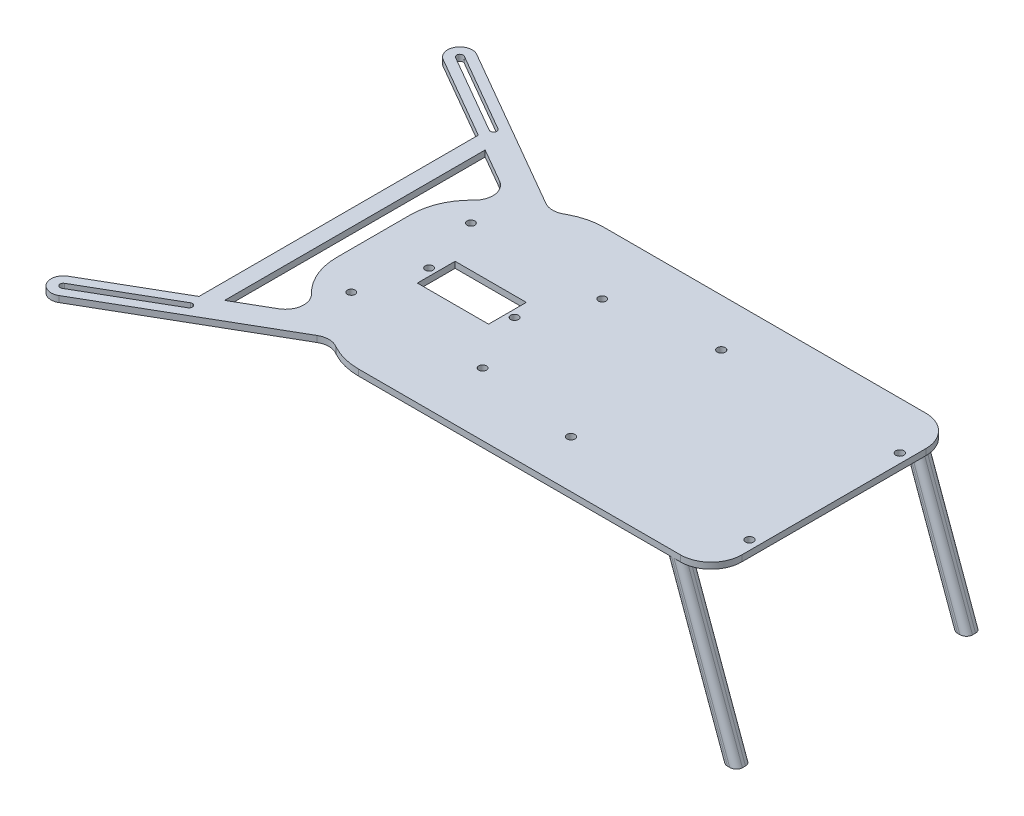
from build123d import *

# Parameters (mm, degrees)
SKETCH_1_W                  = 150
SKETCH_1_H                  = 80
SKETCH_1_R                  = 1.25
EXTRUDE_1_DEPTH             = 2
SKETCH_2_R                  = 1.3
CUT_EXTRUDE_1_DEPTH         = 2
CUT_EXTRUDE_2_DEPTH         = 2
FILLET_1_R                  = 20
FILLET_2_R                  = 10
CUT_EXTRUDE_3_REACH         = 87.024
SKETCH_4_R                  = 1.25
SKETCH_4_W                  = 23.2
SKETCH_4_H                  = 12.3
EXTRUDE_2_DEPTH             = 5
FILLET_5_R                  = 2
EXTRUDE_3_DEPTH             = 2
FILLET_6_R                  = 6
EXTRUDE_4_REACH             = 145.372
SKETCH_7_W                  = 5.296380997
SKETCH_7_H                  = 2
EXTRUDE_4_DIRECTION_2_REACH = 145.372


with BuildPart() as part:
    # 草图1 → 凸台-拉伸1 (new body)
    with BuildSketch(Plane(origin=(0, 0, 0), x_dir=(1, 0, 0), z_dir=(0, 1, 0))):
        Rectangle(SKETCH_1_W, SKETCH_1_H)
        with Locations((-62.8, 19.5)):
            Circle(SKETCH_1_R, mode=Mode.SUBTRACT)
        with Locations((-20, 19.5)):
            Circle(SKETCH_1_R, mode=Mode.SUBTRACT)
        with Locations((-20, -19.5)):
            Circle(SKETCH_1_R, mode=Mode.SUBTRACT)
        with Locations((-62.8, -19.5)):
            Circle(SKETCH_1_R, mode=Mode.SUBTRACT)
    extrude(amount=EXTRUDE_1_DEPTH)

    # 草图2 → 切除-拉伸1 (cut)
    with BuildSketch(Plane(origin=(0, 2, 0), x_dir=(1, 0, 0), z_dir=(0, 1, 0))):
        with Locations((13.8, 24.5)):
            Circle(SKETCH_2_R)
        with Locations((72, 24.5)):
            Circle(SKETCH_2_R)
        with Locations((13.8, -24.5)):
            Circle(SKETCH_2_R)
        with Locations((72, -24.5)):
            Circle(SKETCH_2_R)
    extrude(amount=-CUT_EXTRUDE_1_DEPTH, mode=Mode.SUBTRACT)

    # 草图3 → 切除-拉伸2 (cut)
    with BuildSketch(Plane(origin=(0, 2, 0), x_dir=(1, 0, 0), z_dir=(0, 1, 0))):
        Polygon((-75, 40), (-45, 40), (-75, 24), align=None)
        Polygon((-45, -40), (-75, -24), (-75, -40), align=None)
    extrude(amount=-CUT_EXTRUDE_2_DEPTH, mode=Mode.SUBTRACT)

    # 圆角1
    fillet_1_edges = [part.edges().sort_by_distance(p)[0] for p in [
        (-45, 1, -40),
        (-75, 1, -24),
        (-45, 1, 40),
        (-75, 1, 24),
    ]]
    fillet(fillet_1_edges, radius=FILLET_1_R)

    # 圆角2
    fillet_2_edges = [part.edges().sort_by_distance(p)[0] for p in [
        (75, 1, -40),
        (75, 1, 40),
    ]]
    fillet(fillet_2_edges, radius=FILLET_2_R)

    # 草图4 → 切除-拉伸3 (cut, up to next)
    with BuildSketch(Plane(origin=(0, 2, 0), x_dir=(1, 0, 0), z_dir=(0, 1, 0)), mode=Mode.PRIVATE) as cut_extrude_3_sk1:
        with Locations((-29.075, 0)):
            Circle(SKETCH_4_R)
    cut_extrude_3_tool1 = extrude(cut_extrude_3_sk1.sketch, amount=-CUT_EXTRUDE_3_REACH, mode=Mode.PRIVATE) & part.part
    # 草图4 → 切除-拉伸3 (cut, up to next)
    with BuildSketch(Plane(origin=(0, 2, 0), x_dir=(1, 0, 0), z_dir=(0, 1, 0)), mode=Mode.PRIVATE) as cut_extrude_3_sk2:
        with Locations((-56.925, 0)):
            Circle(SKETCH_4_R)
    cut_extrude_3_tool2 = extrude(cut_extrude_3_sk2.sketch, amount=-CUT_EXTRUDE_3_REACH, mode=Mode.PRIVATE) & part.part
    # 草图4 → 切除-拉伸3 (cut, up to next)
    with BuildSketch(Plane(origin=(0, 2, 0), x_dir=(1, 0, 0), z_dir=(0, 1, 0)), mode=Mode.PRIVATE) as cut_extrude_3_sk3:
        with Locations((-43, 0)):
            Rectangle(SKETCH_4_W, SKETCH_4_H)
    cut_extrude_3_tool3 = extrude(cut_extrude_3_sk3.sketch, amount=-CUT_EXTRUDE_3_REACH, mode=Mode.PRIVATE) & part.part
    add(cut_extrude_3_tool1.solids().sort_by_distance((-29.075, 2, 0))[0], mode=Mode.SUBTRACT)
    add(cut_extrude_3_tool2.solids().sort_by_distance((-56.925, 2, 0))[0], mode=Mode.SUBTRACT)
    add(cut_extrude_3_tool3.solids().sort_by_distance((-43, 2, 0))[0], mode=Mode.SUBTRACT)

    # 草图5 → 凸台-拉伸2 (add)
    with BuildSketch(Plane.XY.offset(40)):
        Polygon((65, 0), (83.198511713, -50), (78.198511713, -50), (60, 0), align=None)
    extrude_2 = extrude(amount=-EXTRUDE_2_DEPTH)

    # 镜向1: 凸台-拉伸2 across plane
    add(extrude_2.mirror(Plane.XY))

    # 圆角5
    fillet_5_edges = [part.edges().sort_by_distance(p)[0] for p in [
        (69.099255857, -25, 40),
        (74.099255857, -25, 40),
        (69.099255857, -25, 35),
        (74.099255857, -25, 35),
        (74.099255857, -25, -40),
        (74.099255857, -25, -35),
        (69.099255857, -25, -35),
        (69.099255857, -25, -40),
    ]]
    fillet(fillet_5_edges, radius=FILLET_5_R)

    # 草图6 → 凸台-拉伸3 (add)
    with BuildSketch(Plane(origin=(0, 2, 0), x_dir=(1, 0, 0), z_dir=(0, 1, 0))):
        with BuildLine():
            Line((-53.24229623, 35.604108677), (-61.559340153, 31.168351918))
            Line((-61.559340153, 31.168351918), (-113.52086438, 61.168351918))
            ThreePointArc((-113.52086438, 61.168351918), (-114.984965996, 66.632453533), (-109.52086438, 68.096555148))
            Line((-109.52086438, 68.096555148), (-53.24229623, 35.604108677))
        make_face()
        with BuildLine():
            Line((-110.99586438, 65.541780207), (-85.015102267, 50.541780207))
            ThreePointArc((-85.015102267, 50.541780207), (-84.630775593, 49.107453533), (-86.065102267, 48.723126859))
            Line((-86.065102267, 48.723126859), (-112.04586438, 63.723126859))
            ThreePointArc((-112.04586438, 63.723126859), (-112.430191054, 65.157453533), (-110.99586438, 65.541780207))
        make_face(mode=Mode.SUBTRACT)
    extrude_3 = extrude(amount=-EXTRUDE_3_DEPTH)

    # 镜向2: 凸台-拉伸3 across plane
    add(extrude_3.mirror(Plane.XY))

    # 圆角6
    fillet_6_edges = [part.edges().sort_by_distance(p)[0] for p in [
        (-53.24229623, 1, 35.604108677),
        (-61.559340153, 1, 31.168351918),
        (-53.24229623, 1, -35.604108677),
        (-61.559340153, 1, -31.168351918),
    ]]
    fillet(fillet_6_edges, radius=FILLET_6_R)

    # 草图7 → 凸台-拉伸4 (add, up to next)
    with BuildSketch(Plane.XY, mode=Mode.PRIVATE) as extrude_4_sk1:
        with Locations((-83.77505941, 1)):
            Rectangle(SKETCH_7_W, SKETCH_7_H)
    extrude_4_tool1 = extrude(extrude_4_sk1.sketch, amount=-EXTRUDE_4_REACH, mode=Mode.PRIVATE) - part.part
    add(extrude_4_tool1.solids().sort_by_distance((-83.775059, 1, 0))[0])

    # 草图7 → 凸台-拉伸4 direction 2 (add, up to next)
    with BuildSketch(Plane.XY, mode=Mode.PRIVATE) as extrude_4_direction_2_sk1:
        with Locations((-83.77505941, 1)):
            Rectangle(SKETCH_7_W, SKETCH_7_H)
    extrude_4_direction_2_tool1 = extrude(extrude_4_direction_2_sk1.sketch, amount=EXTRUDE_4_DIRECTION_2_REACH, mode=Mode.PRIVATE) - part.part
    add(extrude_4_direction_2_tool1.solids().sort_by_distance((-83.775059, 1, 0))[0])


solid = part.part
